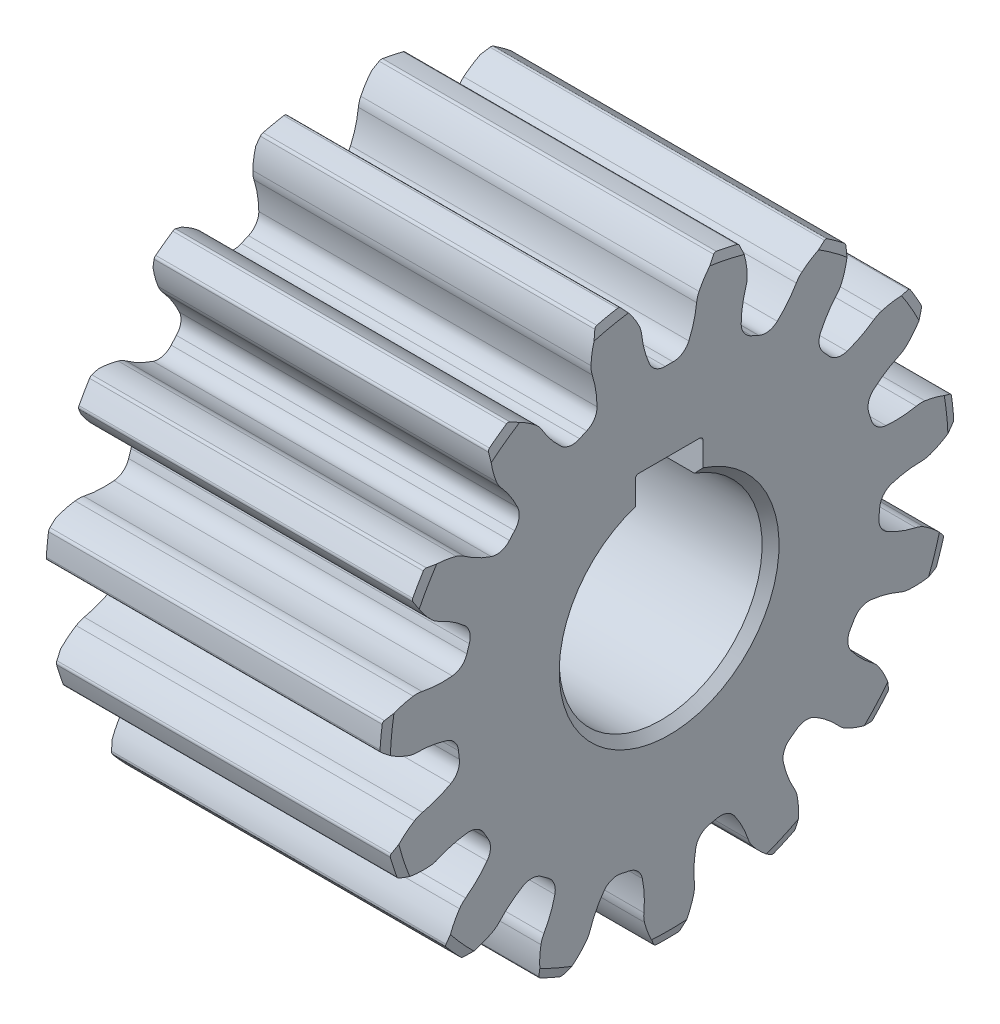
from build123d import *

# Parameters (mm, degrees)
CHAMFER1_SIZE      = 0.5
CUT_EXTRUDE1_DEPTH = 32.272991542
CIRPATTERN1_COUNT  = 15
CUT_EXTRUDE2_DEPTH = 32.251928657


with BuildPart() as part:
    # Sketch1 → Revolve1 (revolve)
    with BuildSketch(Plane.XY):
        Polygon((0, 6), (0, 16.5), (0.133974596, 17), (19.866025404, 17), (20, 16.5), (20, 6), align=None)
    revolve(axis=Axis((0, 0, 0), (1, 0, 0)))

    # Chamfer1
    chamfer1_edges = [part.edges().sort_by_distance(p)[0] for p in [
        (20, -6, 0),
        (0, -6, 0),
    ]]
    chamfer(chamfer1_edges, length=CHAMFER1_SIZE)

    # Sketch2 → Cut-Extrude1 (cut, through all)
    with BuildSketch(Plane(origin=(0, 0, 0), x_dir=(0, 0, -1), z_dir=(1, 0, 0))):
        with BuildLine():
            ThreePointArc((1.167556141, 13.100459852), (1.461960001, 13.95033257), (1.626015607, 14.834664537))
            ThreePointArc((1.626015607, 14.834664537), (1.676131495, 15.088735933), (1.769159726, 15.330416766))
            ThreePointArc((1.769159726, 15.330416766), (2.200062293, 16.052575643), (2.745899369, 16.692303986))
            ThreePointArc((2.745899369, 16.692303986), (2.826763036, 16.740996881), (2.920952742, 16.747179914))
            ThreePointArc((2.920952742, 16.747179914), (0, 17), (-2.920952742, 16.747179914))
            ThreePointArc((-2.920952742, 16.747179914), (-2.826763036, 16.740996881), (-2.745899369, 16.692303986))
            ThreePointArc((-2.745899369, 16.692303986), (-2.200062293, 16.052575643), (-1.769159726, 15.330416766))
            ThreePointArc((-1.769159726, 15.330416766), (-1.676131495, 15.088735933), (-1.626015607, 14.834664537))
            ThreePointArc((-1.626015607, 14.834664537), (-1.461960001, 13.95033257), (-1.167556141, 13.100459852))
            ThreePointArc((-1.167556141, 13.100459852), (-0.791064574, 12.656812338), (-0.231329869, 12.497859276))
            ThreePointArc((-0.231329869, 12.497859276), (0, 12.5), (0.231329869, 12.497859276))
            ThreePointArc((0.231329869, 12.497859276), (0.791064574, 12.656812338), (1.167556141, 13.100459852))
        make_face()
    cut_extrude1 = extrude(amount=CUT_EXTRUDE1_DEPTH, mode=Mode.SUBTRACT)

    # CirPattern1: Cut-Extrude1 ×15 about axis
    cirpattern1_axis = Axis((0, 0, 0), (-1, 0, 0))
    for i in range(1, CIRPATTERN1_COUNT):
        add(cut_extrude1.rotate(cirpattern1_axis, i * 360 / CIRPATTERN1_COUNT), mode=Mode.SUBTRACT)

    # Sketch3 → Cut-Extrude2 (cut, through all)
    with BuildSketch(Plane.ZY):
        with BuildLine():
            Line((-2, 0), (2, 0))
            Line((2, 0), (2, 7.6))
            ThreePointArc((2, 7.6), (1.941421356, 7.741421356), (1.8, 7.8))
            Line((1.8, 7.8), (-1.8, 7.8))
            ThreePointArc((-1.8, 7.8), (-1.941421356, 7.741421356), (-2, 7.6))
            Line((-2, 7.6), (-2, 0))
        make_face()
    extrude(amount=-CUT_EXTRUDE2_DEPTH, mode=Mode.SUBTRACT)


solid = part.part
